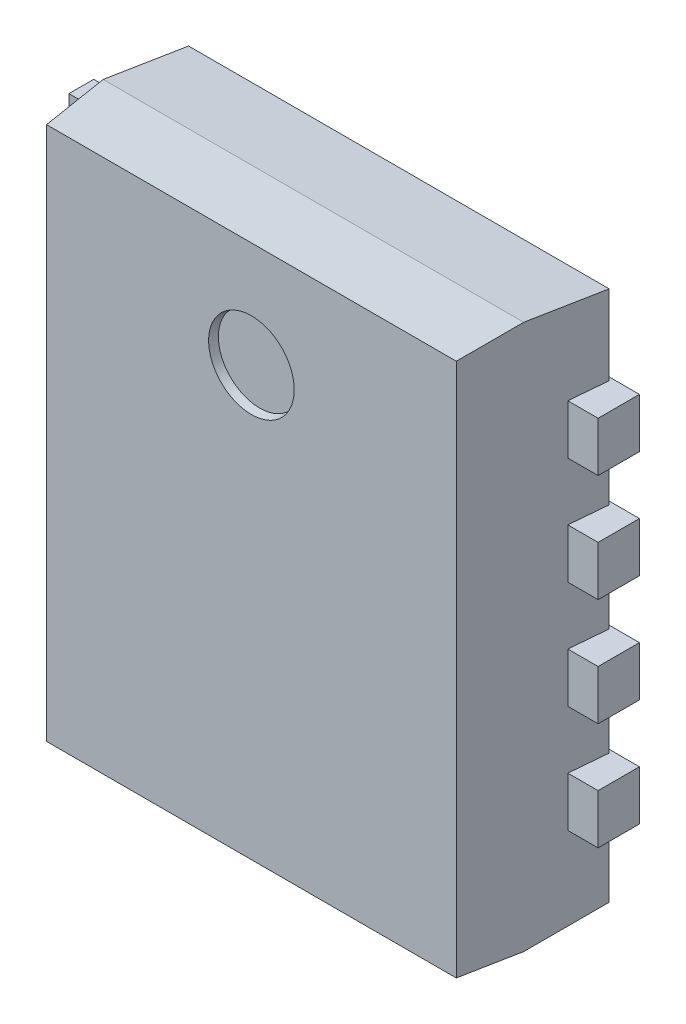
from build123d import *
from OCP.BRepFilletAPI import BRepFilletAPI_MakeChamfer

# Parameters (mm, degrees)
BOSS_EXTRUDE1_DEPTH    = 0.25
FILLET1_R              = 0.1
SKETCH3_W              = 2.6
SKETCH3_H              = 3.3
BOSS_EXTRUDE2_DEPTH    = 0.85
CHAMFER2_SIZE          = 1
CHAMFER2_SIZE_2        = 0.087488664
CHAMFER3_SIZE          = 0.4
CHAMFER3_SIZE2         = 0.034995465
CHAMFER4_SIZE          = 0.043744332
CHAMFER4_SIZE_2        = 0.5
BOSS_EXTRUDE3_DEPTH    = 0.15
FILLET2_R              = 0.1
FILLET3_R              = 0.2
LPATTERN1_COUNT        = 4
LPATTERN1_PITCH        = 0.65
FILLET2_OF_LPATTERN1_R = 0.1
FILLET3_OF_LPATTERN1_R = 0.2
SKETCH5_R              = 0.25
CUT_EXTRUDE1_DEPTH     = 0.05
CHAMFER5_SIZE2         = 0.05
CHAMFER5_SIZE          = 0.008816349


# Some blends are built 0.0001 mm under size
with BuildPart() as part:
    # Sketch2 → Boss-Extrude1 (new body)
    with BuildSketch(Plane.XY):
        Polygon((1.15, 0.175), (1.15, -0.175), (1.65, -0.175), (1.65, -0.475), (1.15, -0.475), (1.15, -0.825), (1.65, -0.825), (1.65, -1.125), (-0.475, -1.125), (-0.475, 1.125), (1.65, 1.125), (1.65, 0.825), (1.15, 0.825), (1.15, 0.475), (1.65, 0.475), (1.65, 0.175), align=None)
    extrude(amount=BOSS_EXTRUDE1_DEPTH)

    # Fillet1
    fillet1_edges = [part.edges().sort_by_distance(p)[0] for p in [
        (-0.475, 1.125, 0.125),
        (1.15, 0.825, 0.125),
        (1.15, 0.475, 0.125),
        (1.15, 0.175, 0.125),
        (1.15, -0.175, 0.125),
        (1.15, -0.475, 0.125),
        (1.15, -0.825, 0.125),
        (-0.475, -1.125, 0.125),
    ]]
    fillet(fillet1_edges, radius=FILLET1_R)

    # Sketch3 → Boss-Extrude2 (add)
    with BuildSketch(Plane.XY.offset(0.02)):
        with Locations((0.2, 0)):
            Rectangle(SKETCH3_W, SKETCH3_H)
    extrude(amount=BOSS_EXTRUDE2_DEPTH)

    # Chamfer2
    # the kernel refuses this chamfer: 1, 0.087488664 mm, written as the material it takes off along each edge
    with BuildSketch(Plane(origin=(1.5, 4.24963408, 0.87), x_dir=(0.0033526157940331684, 0, -0.9999943799678764), z_dir=(0, -1, 0))) as chamfer2_piece_1_section:
        Polygon((CHAMFER2_SIZE * 0.999994379968, -CHAMFER2_SIZE * 0.00335261579403), (-CHAMFER2_SIZE_2 * 0.00335261577587, -CHAMFER2_SIZE_2 * 0.999994374549), (0, 0), align=None)
    chamfer2_piece_1 = extrude(amount=8.49926816, mode=Mode.PRIVATE)
    chamfer2_piece_1 = split(chamfer2_piece_1, bisect_by=Plane(origin=(1.487680055, 1.125, 0.15163522), z_dir=(0, 1, 0)), keep=Keep.TOP, mode=Mode.PRIVATE)
    add(chamfer2_piece_1, mode=Mode.SUBTRACT)
    with BuildSketch(Plane(origin=(1.5, 4.24963408, 0.87), x_dir=(0.0033526157940331684, 0, -0.9999943799678764), z_dir=(0, -1, 0))) as chamfer2_piece_2_section:
        Polygon((CHAMFER2_SIZE * 0.999994379968, -CHAMFER2_SIZE * 0.00335261579403), (-CHAMFER2_SIZE_2 * 0.00335261577587, -CHAMFER2_SIZE_2 * 0.999994374549), (0, 0), align=None)
    chamfer2_piece_2 = extrude(amount=8.49926816, mode=Mode.PRIVATE)
    chamfer2_piece_2 = split(chamfer2_piece_2, bisect_by=Plane(origin=(1.467785575, 0.975, 0.25), z_dir=(0, 0, 1)), keep=Keep.TOP, mode=Mode.PRIVATE)
    add(chamfer2_piece_2, mode=Mode.SUBTRACT)
    with BuildSketch(Plane(origin=(1.5, 4.24963408, 0.87), x_dir=(0.0033526157940331684, 0, -0.9999943799678764), z_dir=(0, -1, 0))) as chamfer2_piece_3_section:
        Polygon((CHAMFER2_SIZE * 0.999994379968, -CHAMFER2_SIZE * 0.00335261579403), (-CHAMFER2_SIZE_2 * 0.00335261577587, -CHAMFER2_SIZE_2 * 0.999994374549), (0, 0), align=None)
    chamfer2_piece_3 = extrude(amount=8.49926816, mode=Mode.PRIVATE)
    chamfer2_piece_3 = split(chamfer2_piece_3, bisect_by=Plane(origin=(1.487680055, 0.475, 0.15163522), z_dir=(0, 1, 0)), keep=Keep.TOP, mode=Mode.PRIVATE)
    chamfer2_piece_3 = split(chamfer2_piece_3, bisect_by=Plane(origin=(1.487680055, 0.825, 0.15163522), z_dir=(0, -1, 0)), keep=Keep.TOP, mode=Mode.PRIVATE)
    add(chamfer2_piece_3, mode=Mode.SUBTRACT)
    with BuildSketch(Plane(origin=(1.5, 4.24963408, 0.87), x_dir=(0.0033526157940331684, 0, -0.9999943799678764), z_dir=(0, -1, 0))) as chamfer2_piece_4_section:
        Polygon((CHAMFER2_SIZE * 0.999994379968, -CHAMFER2_SIZE * 0.00335261579403), (-CHAMFER2_SIZE_2 * 0.00335261577587, -CHAMFER2_SIZE_2 * 0.999994374549), (0, 0), align=None)
    chamfer2_piece_4 = extrude(amount=8.49926816, mode=Mode.PRIVATE)
    chamfer2_piece_4 = split(chamfer2_piece_4, bisect_by=Plane(origin=(1.487680055, 0.175, 0.15163522), z_dir=(0, -1, 0)), keep=Keep.TOP, mode=Mode.PRIVATE)
    chamfer2_piece_4 = split(chamfer2_piece_4, bisect_by=Plane(origin=(1.487680055, -0.175, 0.15163522), z_dir=(0, 1, 0)), keep=Keep.TOP, mode=Mode.PRIVATE)
    add(chamfer2_piece_4, mode=Mode.SUBTRACT)
    with BuildSketch(Plane(origin=(1.5, 4.24963408, 0.87), x_dir=(0.0033526157940331684, 0, -0.9999943799678764), z_dir=(0, -1, 0))) as chamfer2_piece_5_section:
        Polygon((CHAMFER2_SIZE * 0.999994379968, -CHAMFER2_SIZE * 0.00335261579403), (-CHAMFER2_SIZE_2 * 0.00335261577587, -CHAMFER2_SIZE_2 * 0.999994374549), (0, 0), align=None)
    chamfer2_piece_5 = extrude(amount=8.49926816, mode=Mode.PRIVATE)
    chamfer2_piece_5 = split(chamfer2_piece_5, bisect_by=Plane(origin=(1.487680055, -0.475, 0.15163522), z_dir=(0, -1, 0)), keep=Keep.TOP, mode=Mode.PRIVATE)
    chamfer2_piece_5 = split(chamfer2_piece_5, bisect_by=Plane(origin=(1.487680055, -0.825, 0.15163522), z_dir=(0, 1, 0)), keep=Keep.TOP, mode=Mode.PRIVATE)
    add(chamfer2_piece_5, mode=Mode.SUBTRACT)
    with BuildSketch(Plane(origin=(1.5, 4.24963408, 0.87), x_dir=(0.0033526157940331684, 0, -0.9999943799678764), z_dir=(0, -1, 0))) as chamfer2_piece_6_section:
        Polygon((CHAMFER2_SIZE * 0.999994379968, -CHAMFER2_SIZE * 0.00335261579403), (-CHAMFER2_SIZE_2 * 0.00335261577587, -CHAMFER2_SIZE_2 * 0.999994374549), (0, 0), align=None)
    chamfer2_piece_6 = extrude(amount=8.49926816, mode=Mode.PRIVATE)
    chamfer2_piece_6 = split(chamfer2_piece_6, bisect_by=Plane(origin=(1.487680055, -1.125, 0.15163522), z_dir=(0, -1, 0)), keep=Keep.TOP, mode=Mode.PRIVATE)
    add(chamfer2_piece_6, mode=Mode.SUBTRACT)

    # Chamfer3: one chamfer whose edges measure the first distance from different faces: ONE call of the kernel's chamfer builder (chamfer() names one face for all edges)
    chamfer3_edges_1 = [part.edges().sort_by_distance(p)[0] for p in [
        (-1.1, 0, 0.87),
    ]]
    chamfer3_side_1 = [part.faces().sort_by_distance(p)[0] for p in [
        (-1.1, 0, 0.445),
    ]]
    chamfer3_edges_2 = [part.edges().sort_by_distance(p)[0] for p in [
        (0.156255668, -1.65, 0.87),
    ]]
    chamfer3_side_2 = [part.faces().sort_by_distance(p)[0] for p in [
        (0.174937383, -1.65, 0.442934048),
    ]]
    chamfer3_edges_3 = [part.edges().sort_by_distance(p)[0] for p in [
        (0.156255668, 1.65, 0.87),
    ]]
    chamfer3_side_3 = [part.faces().sort_by_distance(p)[0] for p in [
        (0.174937383, 1.65, 0.442934048),
    ]]
    chamfer3 = BRepFilletAPI_MakeChamfer(part.part.solid().wrapped)
    for e in chamfer3_edges_1:
        chamfer3.Add(CHAMFER3_SIZE, CHAMFER3_SIZE2, e.wrapped, chamfer3_side_1[0].wrapped)  # the first distance lies on this face
    for e in chamfer3_edges_2:
        chamfer3.Add(CHAMFER3_SIZE, CHAMFER3_SIZE2, e.wrapped, chamfer3_side_2[0].wrapped)  # the first distance lies on this face
    for e in chamfer3_edges_3:
        chamfer3.Add(CHAMFER3_SIZE, CHAMFER3_SIZE2, e.wrapped, chamfer3_side_3[0].wrapped)  # the first distance lies on this face
    add(Compound.cast(chamfer3.Shape()), mode=Mode.REPLACE)

    # Chamfer4
    # the kernel refuses this chamfer: 0.5, 0.043744332 mm, written as the material it takes off along each edge
    with BuildSketch(Plane(origin=(-2.39981704, 1.65, 0.02), x_dir=(0, -0.9159861691531118, -0.4012098427509062), z_dir=(1, 0, 0))) as chamfer4_piece_1:
        Polygon((CHAMFER4_SIZE * 0.91598616419, -CHAMFER4_SIZE * 0.401209840577), (-CHAMFER4_SIZE_2 * 0.401209842751, -CHAMFER4_SIZE_2 * 0.915986169153), (0, 0), align=None)
    extrude(amount=5.18651078, mode=Mode.SUBTRACT)
    with BuildSketch(Plane(origin=(-1.1, -2.94981704, 0.02), x_dir=(0.9159861691531118, 0, -0.4012098427509062), z_dir=(0, 1, 0))) as chamfer4_piece_2:
        Polygon((CHAMFER4_SIZE * 0.91598616419, -CHAMFER4_SIZE * 0.401209840577), (-CHAMFER4_SIZE_2 * 0.401209842751, -CHAMFER4_SIZE_2 * 0.915986169153), (0, 0), align=None)
    extrude(amount=5.89963408, mode=Mode.SUBTRACT)
    with BuildSketch(Plane(origin=(2.78669374, -1.65, 0.02), x_dir=(0, -0.0033526157940331684, 0.9999943799678764), z_dir=(-1, 0, 0))) as chamfer4_piece_3:
        Polygon((CHAMFER4_SIZE_2 * 0.999994379968, CHAMFER4_SIZE_2 * 0.00335261579403), (-CHAMFER4_SIZE * 0.00335261577587, CHAMFER4_SIZE * 0.999994374549), (0, 0), align=None)
    extrude(amount=5.18651078, mode=Mode.SUBTRACT)

    # Sketch4 → Boss-Extrude3 (add, symmetric)
    with BuildSketch(Plane(origin=(0, 0.975, 0), x_dir=(1, 0, 0), z_dir=(0, 1, 0))):
        Polygon((-1.65, 0), (-1.25, 0), (-1.15, -0.5), (-0.849772873, -0.5), (-0.849772873, -0.65), (-1.272970585, -0.65), (-1.372970585, -0.15), (-1.65, -0.15), align=None)
    boss_extrude3 = extrude(amount=BOSS_EXTRUDE3_DEPTH, both=True)

    # Fillet2
    # the kernel refuses this fillet: 0.1 mm, written as the material it adds along each edge
    with BuildSketch(Plane(origin=(-1.372970585, 0.825, 0.15), x_dir=(0.19611613513818507, 0, 0.98058067569092), z_dir=(0, 1, 0))) as fillet2_piece_1:
        with BuildLine():
            CenterArc((FILLET2_R * 0.819803902719, -FILLET2_R), FILLET2_R, 90, 78.690067526)
            Line((-FILLET2_R * 0.160776772972, -FILLET2_R * 0.803883864862), (-FILLET2_R * 0.180388386486, -FILLET2_R * 0.799961542159))
            Line((-FILLET2_R * 0.180388386486, -FILLET2_R * 0.799961542159), (-FILLET2_R * 0.0163960780544, FILLET2_R * 0.02))
            Line((-FILLET2_R * 0.0163960780544, FILLET2_R * 0.02), (FILLET2_R * 0.819803902719, FILLET2_R * 0.02))
            Line((FILLET2_R * 0.819803902719, FILLET2_R * 0.02), (FILLET2_R * 0.819803902719, 0))
        make_face()
    extrude(amount=0.3)
    with BuildSketch(Plane(origin=(-1.15, 1.125, 0.5), x_dir=(1, 0, 0), z_dir=(0, -1, 0))) as fillet2_piece_2:
        with BuildLine():
            CenterArc((0.082920302, -0.095300441), FILLET2_R, 107.635259495, 61.054808031)
            Line((-0.015137766, -0.075688828), (-0.017098927, -0.075296595))
            Line((-0.017098927, -0.075296595), (-0.001961161, 0.000392232))
            Line((-0.001961161, 0.000392232), (0, 0.002))
            ThreePointArc((0, 0.002), (0.02631233, 0.002), (0.052018747, 0.001906009))
            Line((0.052018747, 0.001906009), (0.05262466, 0))
        make_face()
    extrude(amount=0.3)

    # Fillet3
    fillet3_edges = [part.edges().sort_by_distance(p)[0] for p in [
        (-1.272970585, 0.975, 0.65),
        (-1.25, 0.975, 0),
    ]]
    fillet(fillet3_edges, radius=FILLET3_R)

    # LPattern1: Boss-Extrude3 ×4
    with Locations(*[(0, -i * LPATTERN1_PITCH, 0) for i in range(1, LPATTERN1_COUNT)]):
        add(boss_extrude3)

    # Fillet2 of LPattern1
    # the kernel refuses this fillet: 0.1 mm, written as the material it adds along each edge
    with BuildSketch(Plane(origin=(-1.372970585, 0.175, 0.15), x_dir=(0.19611613513818507, 0, 0.98058067569092), z_dir=(0, 1, 0)), Plane(origin=(-1.372970585, -0.475, 0.15), x_dir=(0.19611613513818507, 0, 0.98058067569092), z_dir=(0, 1, 0)), Plane(origin=(-1.372970585, -1.125, 0.15), x_dir=(0.19611613513818507, 0, 0.98058067569092), z_dir=(0, 1, 0))) as fillet2_of_lpattern1_piece_1:
        with BuildLine():
            CenterArc((FILLET2_OF_LPATTERN1_R * 0.819803902719, -FILLET2_OF_LPATTERN1_R), FILLET2_OF_LPATTERN1_R, 90, 78.690067526)
            Line((-FILLET2_OF_LPATTERN1_R * 0.160776772972, -FILLET2_OF_LPATTERN1_R * 0.803883864862), (-FILLET2_OF_LPATTERN1_R * 0.180388386486, -FILLET2_OF_LPATTERN1_R * 0.799961542159))
            Line((-FILLET2_OF_LPATTERN1_R * 0.180388386486, -FILLET2_OF_LPATTERN1_R * 0.799961542159), (-FILLET2_OF_LPATTERN1_R * 0.0163960780544, FILLET2_OF_LPATTERN1_R * 0.02))
            Line((-FILLET2_OF_LPATTERN1_R * 0.0163960780544, FILLET2_OF_LPATTERN1_R * 0.02), (FILLET2_OF_LPATTERN1_R * 0.819803902719, FILLET2_OF_LPATTERN1_R * 0.02))
            Line((FILLET2_OF_LPATTERN1_R * 0.819803902719, FILLET2_OF_LPATTERN1_R * 0.02), (FILLET2_OF_LPATTERN1_R * 0.819803902719, 0))
        make_face()
    extrude(amount=0.3)
    with BuildSketch(Plane(origin=(-1.15, 0.475, 0.5), x_dir=(1, 0, 0), z_dir=(0, -1, 0)), Plane(origin=(-1.15, -0.175, 0.5), x_dir=(1, 0, 0), z_dir=(0, -1, 0)), Plane(origin=(-1.15, -0.825, 0.5), x_dir=(1, 0, 0), z_dir=(0, -1, 0))) as fillet2_of_lpattern1_piece_2:
        with BuildLine():
            CenterArc((0.082920302, -0.095300441), FILLET2_OF_LPATTERN1_R, 107.635259495, 61.054808031)
            Line((-0.015137766, -0.075688828), (-0.017098927, -0.075296595))
            Line((-0.017098927, -0.075296595), (-0.001961161, 0.000392232))
            Line((-0.001961161, 0.000392232), (0, 0.002))
            ThreePointArc((0, 0.002), (0.02631233, 0.002), (0.052018747, 0.001906009))
            Line((0.052018747, 0.001906009), (0.05262466, 0))
        make_face()
    extrude(amount=0.3)

    # Fillet3 of LPattern1
    fillet3_of_lpattern1_edges = [part.edges().sort_by_distance(p)[0] for p in [
        (-1.272970585, 0.325, 0.65),
        (-1.25, 0.325, 0),
        (-1.272970585, -0.325, 0.65),
        (-1.25, -0.325, 0),
        (-1.272970585, -0.975, 0.65),
        (-1.25, -0.975, 0),
    ]]
    fillet(fillet3_of_lpattern1_edges, radius=FILLET3_OF_LPATTERN1_R)

    # Sketch5 → Cut-Extrude1 (cut)
    with BuildSketch(Plane.XY.offset(0.87)):
        with Locations((0.173753401, 0.975)):
            Circle(SKETCH5_R)
    extrude(amount=-CUT_EXTRUDE1_DEPTH, mode=Mode.SUBTRACT)

    # Chamfer5
    chamfer5_edges = [part.edges().sort_by_distance(p)[0] for p in [
        (-0.076246599, 0.975, 0.87),
    ]]
    chamfer5_side = [part.faces().sort_by_distance(p)[0] for p in [
        (-0.076422926, 0.975, 0.87),
    ]]
    chamfer(chamfer5_edges, length=CHAMFER5_SIZE - 0.0001, length2=CHAMFER5_SIZE2 - 0.0001, reference=chamfer5_side[0])  # a hair under: the kernel refuses the full size


solid = part.part
